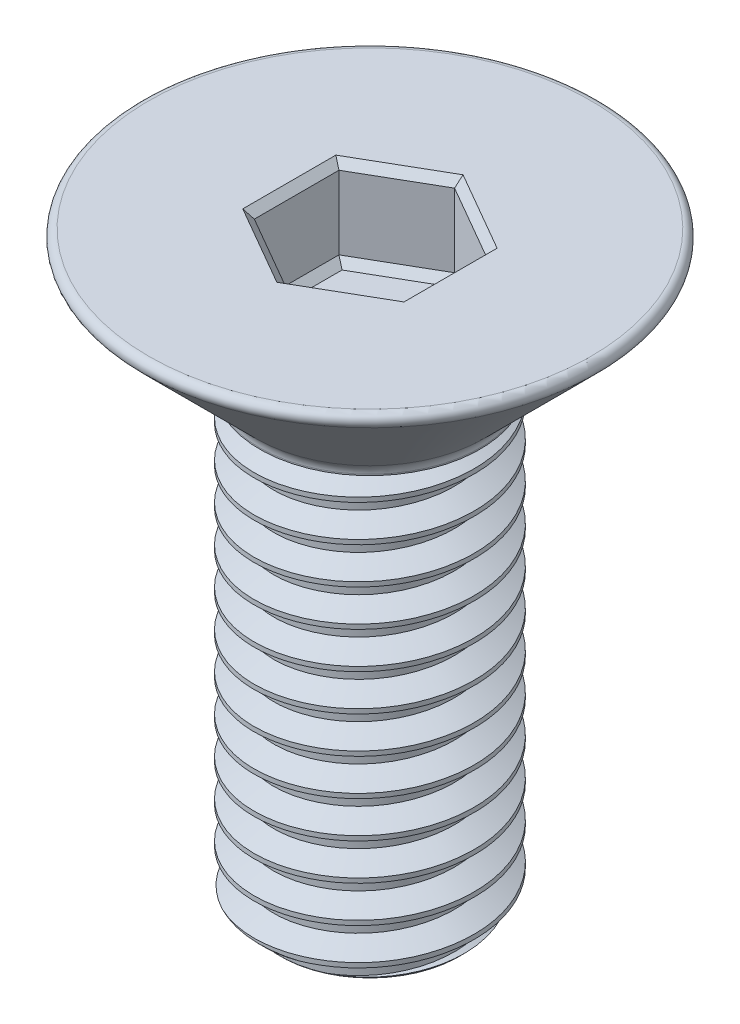
from build123d import *

# Parameters (mm, degrees)
SKETCH1_R           = 1.5
BOSS_EXTRUDE1_DEPTH = 6.14
THREAD1_PITCH       = 0.5
SKETCH5_R           = 1.5
BOSS_EXTRUDE2_DEPTH = 0.1
SKETCH6_R           = 1.5
BOSS_EXTRUDE3_DEPTH = 1.76
BOSS_EXTRUDE3_DRAFT = -45
FILLET1_R           = 0.1
FILLET2_R           = 0.2
CUT_EXTRUDE1_DEPTH  = 1.1
CHAMFER1_SIZE       = 0.1
CUT_EXTRUDE2_DEPTH  = 0.1
CUT_EXTRUDE2_DRAFT  = -45


with BuildPart() as part:
    # Sketch1 → Boss-Extrude1 (new body)
    with BuildSketch(Plane(origin=(0, 0, 0), x_dir=(1, 0, 0), z_dir=(0, 1, 0))):
        with Locations(Location((0, 0, 0), (0, 0, 270))):
            Circle(SKETCH1_R)
    extrude(amount=BOSS_EXTRUDE1_DEPTH)

    # Thread1: the profile of Thread Profile1 profile screwed along a right-hand helix of 14.28 turns, 6 arcs to a turn; built about Z, then put on its axis
    thread1_z = Axis((0, 0, 0), (0, 0, 1))
    thread1_corners = [(1.5003, 0, -0.000173205), (1.5003, 0, 0.437673204), (1.229367063, 0, 0.281249999), (1.229367063, 0, 0.156249999)]
    with BuildLine(mode=Mode.PRIVATE) as thread1_profile:
        Line(thread1_corners[0], thread1_corners[1])
        Line(thread1_corners[1], thread1_corners[2])
        Line(thread1_corners[2], thread1_corners[3])
        Line(thread1_corners[3], thread1_corners[0])
    thread1_cap = Face(thread1_profile.wire())
    thread1_turn_angles = [0, 30, 60, 90, 120, 150, 180, 210, 240, 270, 300, 330, 360]
    thread1_turn_weights = [1, 0.8660254037844387, 1, 0.8660254037844387, 1, 0.8660254037844387, 1, 0.8660254037844387, 1, 0.8660254037844387, 1, 0.8660254037844387, 1]
    thread1_turn_rails = [Edge.make_bspline([Vector(p[0], p[1], 0).rotate(thread1_z, thread1_turn_angles[k]) / thread1_turn_weights[k] + Vector(0, 0, p[2] + THREAD1_PITCH * thread1_turn_angles[k] / 360) for k in range(13)], [0, 0, 0, 1, 1, 2, 2, 3, 3, 4, 4, 5, 5, 6, 6, 6], 2, thread1_turn_weights) for p in thread1_corners]
    thread1_turn_sides = [Face.make_surface_from_curves(thread1_turn_rails[p[0]], thread1_turn_rails[p[1]]) for p in [(0, 1), (1, 2), (2, 3), (3, 0)]]
    thread1_last_angles = [5040, 5070, 5100, 5120.4, 5140.8]
    thread1_last_weights = [1, 0.8660254037844387, 1, 0.9372819894918909, 1]
    thread1_last_rails = [Edge.make_bspline([Vector(p[0], p[1], 0).rotate(thread1_z, thread1_last_angles[k]) / thread1_last_weights[k] + Vector(0, 0, p[2] + THREAD1_PITCH * thread1_last_angles[k] / 360) for k in range(5)], [0, 0, 0, 1, 1, 2, 2, 2], 2, thread1_last_weights) for p in thread1_corners]
    thread1_last_sides = [Face.make_surface_from_curves(thread1_last_rails[p[0]], thread1_last_rails[p[1]]) for p in [(0, 1), (1, 2), (2, 3), (3, 0)]]
    thread1 = Plane(origin=(0, 7.14, 0), x_dir=(-1, 0, 0), z_dir=(0, -1, 0)) * Solid(Shell([*[p.moved(Location((0, 0, THREAD1_PITCH * i))) for i in range(14) for p in thread1_turn_sides], *thread1_last_sides, thread1_cap, thread1_cap.rotate(thread1_z, 5140.8).moved(Location((0, 0, THREAD1_PITCH * 5140.8 / 360)))]))
    add(thread1, mode=Mode.SUBTRACT)

    # Sketch5 → Boss-Extrude2 (add)
    with BuildSketch(Plane(origin=(0, 6.14, 0), x_dir=(1, 0, 0), z_dir=(0, 1, 0))):
        with Locations(Location((0, 0, 0), (0, 0, 79.630240194))):
            Circle(SKETCH5_R)
    extrude(amount=BOSS_EXTRUDE2_DEPTH)


with BuildPart() as boss_extrude3_tool:
    # Sketch6 → Boss-Extrude3 (with draft: the straight prism first)
    with BuildSketch(Plane(origin=(0, 6.24, 0), x_dir=(1, 0, 0), z_dir=(0, 1, 0))):
        with Locations(Location((0, 0, 0), (0, 0, 79.630240194))):
            Circle(SKETCH6_R)
    extrude(amount=BOSS_EXTRUDE3_DEPTH)
    # Boss-Extrude3: the draft: its side faces are tilted about the plane it starts from
    boss_extrude3_sides = [boss_extrude3_tool.faces().sort_by_distance(p)[0] for p in [
        (-0.27, 7.12, 1.475499915),
    ]]
    draft(boss_extrude3_sides, Plane(origin=(0, 6.24, 0), x_dir=(1, 0, 0), z_dir=(0, 1, 0)), BOSS_EXTRUDE3_DRAFT)


with BuildPart() as part_1:
    add(part.part)

    # Boss-Extrude3: add boss_extrude3_tool
    add(boss_extrude3_tool.part)

    # Sketch7 → Cut-Revolve1 (revolve, cut)
    with BuildSketch(Plane.XY, mode=Mode.PRIVATE) as cut_revolve1_sk:
        Polygon((1.51, 0), (1.51, 0.3), (1.21, 0), align=None)
    revolve(cut_revolve1_sk.sketch.rotate(Axis((0, 0, 0), (0, 1, 0)), 135.522486844), axis=Axis((0, 0, 0), (0, 1, 0)), mode=Mode.SUBTRACT)

    # Fillet1
    fillet1_edges = [part_1.edges().sort_by_distance(p)[0] for p in [
        (-0.5868, 8, 3.206753149),
    ]]
    fillet(fillet1_edges, radius=FILLET1_R)

    # Fillet2
    fillet2_edges = [part_1.edges().sort_by_distance(p)[0] for p in [
        (-0.27, 6.24, 1.475499915),
    ]]
    fillet(fillet2_edges, radius=FILLET2_R)

    # Sketch8 → Cut-Extrude1 (cut)
    with BuildSketch(Plane(origin=(0, 8, 0), x_dir=(1, 0, 0), z_dir=(0, 1, 0))):
        Polygon((0, 1.154700538), (-1, 0.577350269), (-1, -0.577350269), (0, -1.154700538), (1, -0.577350269), (1, 0.577350269), align=None)
    extrude(amount=-CUT_EXTRUDE1_DEPTH, mode=Mode.SUBTRACT)

    # Chamfer1
    chamfer1_edges = [part_1.edges().sort_by_distance(p)[0] for p in [
        (0.5, 8, -0.866025404),
        (-0.5, 8, -0.866025404),
        (-1, 8, 0),
        (-0.5, 8, 0.866025404),
        (0.5, 8, 0.866025404),
        (1, 8, 0),
    ]]
    chamfer(chamfer1_edges, length=CHAMFER1_SIZE)


with BuildPart() as cut_extrude2_tool:
    # Sketch9 → Cut-Extrude2 (with draft: the straight prism first)
    with BuildSketch(Plane(origin=(0, 6.9, 0), x_dir=(1, 0, 0), z_dir=(0, 1, 0))):
        Polygon((0, 1.154700538), (-1, 0.577350269), (-1, -0.577350269), (0, -1.154700538), (1, -0.577350269), (1, 0.577350269), align=None)
    extrude(amount=-CUT_EXTRUDE2_DEPTH)
    # Cut-Extrude2: the draft: its side faces are tilted about the plane it starts from
    cut_extrude2_sides = [cut_extrude2_tool.faces().sort_by_distance(p)[0] for p in [
        (-0.5, 6.85, -0.866025404),
        (-1, 6.85, 0),
        (-0.5, 6.85, 0.866025404),
        (0.5, 6.85, 0.866025404),
        (1, 6.85, 0),
        (0.5, 6.85, -0.866025404),
    ]]
    draft(cut_extrude2_sides, Plane(origin=(0, 6.9, 0), x_dir=(1, 0, 0), z_dir=(0, 1, 0)), CUT_EXTRUDE2_DRAFT)


with BuildPart() as part_2:
    add(part_1.part)

    # Cut-Extrude2: cut by cut_extrude2_tool
    add(cut_extrude2_tool.part, mode=Mode.SUBTRACT)


solid = part_2.part
